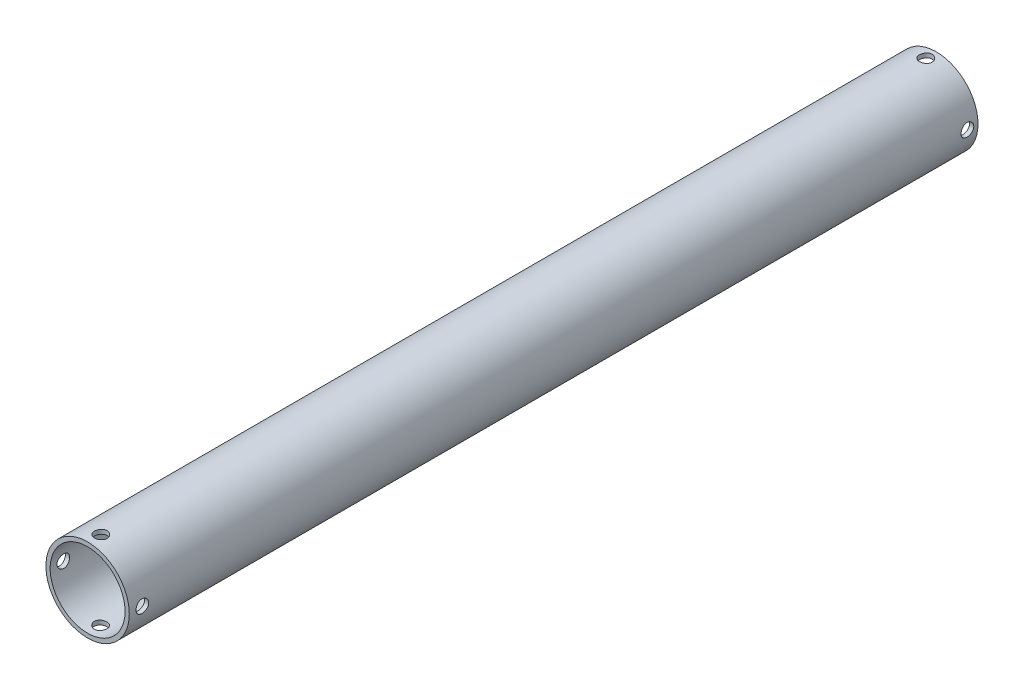
from build123d import *

# Parameters (mm, degrees)
ESBO_O1_R                      = 9.85
ESBO_O1_R_2                    = 8.85
RESSALTO_EXTRUS_O1_DEPTH       = 200.6
ESBO_O3_R                      = 1.5
CORTE_EXTRUS_O1_DEPTH          = 202.083079845
PADR_OCIRCULAR1_COUNT          = 4
PADR_O_LINEAR1_COPY_1_SKETCH_R = 1.5
PADR_O_LINEAR1_COPY_1_DEPTH    = 202.083079845
PADR_O_LINEAR1_COPY_2_SKETCH_R = 1.5
PADR_O_LINEAR1_COPY_2_DEPTH    = 202.083079845
PADR_O_LINEAR1_COPY_3_SKETCH_R = 1.5
PADR_O_LINEAR1_COPY_3_DEPTH    = 202.083079845
PADR_O_LINEAR1_COPY_4_SKETCH_R = 1.5
PADR_O_LINEAR1_COPY_4_DEPTH    = 202.083079845


with BuildPart() as part:
    # Esboço1 → Ressalto-extrusão1 (new body)
    with BuildSketch(Plane.XY):
        Circle(ESBO_O1_R)
        Circle(ESBO_O1_R_2, mode=Mode.SUBTRACT)
    extrude(amount=RESSALTO_EXTRUS_O1_DEPTH)

    # Esboço3 → Corte-extrusão1 (cut, through all)
    with BuildSketch(Plane(origin=(0, 0, 0), x_dir=(1, 0, 0), z_dir=(0, 1, 0))):
        with Locations((0, -2.5)):
            Circle(ESBO_O3_R)
    corte_extrus_o1 = extrude(amount=-CORTE_EXTRUS_O1_DEPTH, mode=Mode.SUBTRACT)

    # PadrãoCircular1: Corte-extrusão1 ×4 about axis
    padr_ocircular1_axis = Axis((0, 0, 0), (0, 0, 1))
    for i in range(1, PADR_OCIRCULAR1_COUNT):
        add(corte_extrus_o1.rotate(padr_ocircular1_axis, i * 360 / PADR_OCIRCULAR1_COUNT), mode=Mode.SUBTRACT)

    # Padrão linear1 copy 1 sketch → Padrão linear1 copy 1 (cut, through all)
    with BuildSketch(Plane(origin=(0, 0, 195), x_dir=(0, 1, 0), z_dir=(-1, 0, 0))):
        with Locations((0, -2.5)):
            Circle(PADR_O_LINEAR1_COPY_1_SKETCH_R)
    extrude(amount=-PADR_O_LINEAR1_COPY_1_DEPTH, mode=Mode.SUBTRACT)

    # Padrão linear1 copy 2 sketch → Padrão linear1 copy 2 (cut, through all)
    with BuildSketch(Plane(origin=(0, 0, 195), x_dir=(-1, 0, 0), z_dir=(0, -1, 0))):
        with Locations((0, -2.5)):
            Circle(PADR_O_LINEAR1_COPY_2_SKETCH_R)
    extrude(amount=-PADR_O_LINEAR1_COPY_2_DEPTH, mode=Mode.SUBTRACT)

    # Padrão linear1 copy 3 sketch → Padrão linear1 copy 3 (cut, through all)
    with BuildSketch(Plane(origin=(0, 0, 195), x_dir=(0, -1, 0), z_dir=(1, 0, 0))):
        with Locations((0, -2.5)):
            Circle(PADR_O_LINEAR1_COPY_3_SKETCH_R)
    extrude(amount=-PADR_O_LINEAR1_COPY_3_DEPTH, mode=Mode.SUBTRACT)

    # Padrão linear1 copy 4 sketch → Padrão linear1 copy 4 (cut, through all)
    with BuildSketch(Plane(origin=(0, 0, 195), x_dir=(1, 0, 0), z_dir=(0, 1, 0))):
        with Locations((0, -2.5)):
            Circle(PADR_O_LINEAR1_COPY_4_SKETCH_R)
    extrude(amount=-PADR_O_LINEAR1_COPY_4_DEPTH, mode=Mode.SUBTRACT)


solid = part.part
